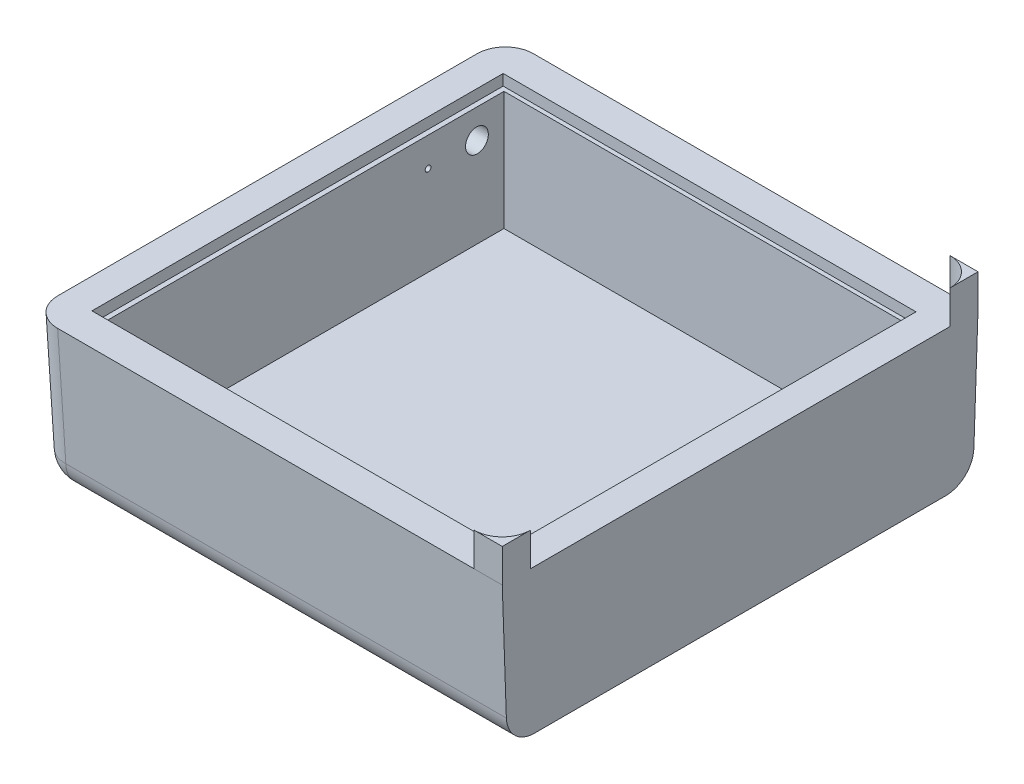
from build123d import *

# Parameters (mm, degrees)
SKETCH1_W               = 295
SKETCH1_H               = 292.1
BOSS_EXTRUDE1_DEPTH     = 88.69
BOSS_EXTRUDE1_DRAFT     = -2
SKETCH3_W               = 253.5
SKETCH3_H               = 252.5
CUT_EXTRUDE3_DEPTH      = 6.5
CUT_EXTRUDE3_DRAFT      = -2
SKETCH5_W               = 247
SKETCH5_H               = 247
CUT_EXTRUDE4_DEPTH      = 70.5
CUT_EXTRUDE4_DRAFT      = -2
CUT_EXTRUDE5_DEPTH      = 228.203831614
CUT_EXTRUDE5_DEPTH_BACK = 228.203831614
FILLET2_R               = 17.27
BOSS_EXTRUDE2_DEPTH     = 20.53
CUT_EXTRUDE6_REACH      = 337.359
SKETCH8_R               = 7
CUT_EXTRUDE7_DEPTH      = 5
CUT_EXTRUDE8_REACH      = 333.091
SKETCH9_R               = 1.75


with BuildPart() as part:
    # Sketch1 → Boss-Extrude1 (with draft: the straight prism first)
    with BuildSketch(Plane(origin=(0, 0, 0), x_dir=(1, 0, 0), z_dir=(0, 1, 0))):
        with Locations((2.25, 0)):
            Rectangle(SKETCH1_W, SKETCH1_H)
    extrude(amount=-BOSS_EXTRUDE1_DEPTH)
    # Boss-Extrude1: the draft: its side faces are tilted about the plane it starts from
    boss_extrude1_sides = [part.faces().sort_by_distance(p)[0] for p in [
        (2.25, -44.345, 146.05),
        (149.75, -44.345, 0),
        (2.25, -44.345, -146.05),
        (-145.25, -44.345, 0),
    ]]
    draft(boss_extrude1_sides, Plane(origin=(0, 0, 0), x_dir=(1, 0, 0), z_dir=(0, 1, 0)), BOSS_EXTRUDE1_DRAFT)


with BuildPart() as cut_extrude3_tool:
    # Sketch3 → Cut-Extrude3 (with draft: the straight prism first)
    with BuildSketch(Plane(origin=(0, 0, 0), x_dir=(1, 0, 0), z_dir=(0, 1, 0))):
        Rectangle(SKETCH3_W, SKETCH3_H)
    extrude(amount=-CUT_EXTRUDE3_DEPTH)
    # Cut-Extrude3: the draft: its side faces are tilted about the plane it starts from
    cut_extrude3_sides = [cut_extrude3_tool.faces().sort_by_distance(p)[0] for p in [
        (0, -3.25, 126.25),
        (126.75, -3.25, 0),
        (0, -3.25, -126.25),
        (-126.75, -3.25, 0),
    ]]
    draft(cut_extrude3_sides, Plane(origin=(0, 0, 0), x_dir=(1, 0, 0), z_dir=(0, 1, 0)), CUT_EXTRUDE3_DRAFT)


with BuildPart() as part_1:
    add(part.part)

    # Cut-Extrude3: cut by cut_extrude3_tool
    add(cut_extrude3_tool.part, mode=Mode.SUBTRACT)


with BuildPart() as cut_extrude4_tool:
    # Sketch5 → Cut-Extrude4 (with draft: the straight prism first)
    with BuildSketch(Plane(origin=(0, -6.5, 0), x_dir=(1, 0, 0), z_dir=(0, 1, 0))):
        Rectangle(SKETCH5_W, SKETCH5_H)
    extrude(amount=-CUT_EXTRUDE4_DEPTH)
    # Cut-Extrude4: the draft: its side faces are tilted about the plane it starts from
    cut_extrude4_sides = [cut_extrude4_tool.faces().sort_by_distance(p)[0] for p in [
        (0, -41.75, 123.5),
        (123.5, -41.75, 0),
        (0, -41.75, -123.5),
        (-123.5, -41.75, 0),
    ]]
    draft(cut_extrude4_sides, Plane(origin=(0, -6.5, 0), x_dir=(1, 0, 0), z_dir=(0, 1, 0)), CUT_EXTRUDE4_DRAFT)


with BuildPart() as part_2:
    add(part_1.part)

    # Cut-Extrude4: cut by cut_extrude4_tool
    add(cut_extrude4_tool.part, mode=Mode.SUBTRACT)

    # Sketch6 → Cut-Extrude5 (cut, two sides: drawn at the far end of the back side and taken through both)
    with BuildSketch(Plane.XY.offset(-CUT_EXTRUDE5_DEPTH_BACK)):
        Polygon((149.75, 0), (145, 0), (145, -88.69), (146.652876954, -88.69), align=None)
    extrude(amount=CUT_EXTRUDE5_DEPTH + CUT_EXTRUDE5_DEPTH_BACK, mode=Mode.SUBTRACT)

    # Fillet2
    fillet2_edges = [part_2.edges().sort_by_distance(p)[0] for p in [
        (1.423561523, -88.69, -142.952876954),
        (-143.701438477, -44.345, -144.501438477),
        (-142.152876954, -88.69, 0),
        (-143.701438477, -44.345, 144.501438477),
        (1.423561523, -88.69, 142.952876954),
    ]]
    fillet(fillet2_edges, radius=FILLET2_R)

    # Sketch7 → Boss-Extrude2 (add)
    with BuildSketch(Plane(origin=(0, 0, 0), x_dir=(1, 0, 0), z_dir=(0, 1, 0))):
        with BuildLine():
            Line((145, 128.78), (145, 146.05))
            Line((145, 146.05), (127.73, 146.05))
            ThreePointArc((127.73, 146.05), (139.941734111, 140.991734111), (145, 128.78))
        make_face()
        with BuildLine():
            Line((145, -146.05), (127.73, -146.05))
            ThreePointArc((127.73, -146.05), (139.941734111, -140.991734111), (145, -128.78))
            Line((145, -128.78), (145, -146.05))
        make_face()
    extrude(amount=BOSS_EXTRUDE2_DEPTH)

    # Sketch8 → Cut-Extrude6 (cut, up to next)
    with BuildSketch(Plane(origin=(-145.07308915, -5.066063906, 0), x_dir=(0, 0, 1), z_dir=(-0.9993908270190958, -0.03489949670250105, 0)), mode=Mode.PRIVATE) as cut_extrude6_sk1:
        with Locations((-106.3, -19.400848104)):
            Circle(SKETCH8_R)
    cut_extrude6_tool1 = extrude(cut_extrude6_sk1.sketch, amount=-CUT_EXTRUDE6_REACH, mode=Mode.PRIVATE) & part_2.part
    add(cut_extrude6_tool1.solids().sort_by_distance((-144.396009, -24.455094, -106.3))[0], mode=Mode.SUBTRACT)

    # Sketch8<3> → Cut-Extrude7 (cut)
    with BuildSketch(Plane(origin=(-145.07308915, -5.066063906, 0), x_dir=(0, 0, 1), z_dir=(-0.9993908270190958, -0.03489949670250105, 0))):
        with BuildLine():
            ThreePointArc((-82, -21.250848104), (-81.707106781, -21.957954885), (-81, -22.250848104))
            Line((-81, -22.250848104), (-71.6, -22.250848104))
            ThreePointArc((-71.6, -22.250848104), (-70.892893219, -21.957954885), (-70.6, -21.250848104))
            Line((-70.6, -21.250848104), (-70.6, -17.550848104))
            ThreePointArc((-70.6, -17.550848104), (-70.892893219, -16.843741323), (-71.6, -16.550848104))
            Line((-71.6, -16.550848104), (-81, -16.550848104))
            ThreePointArc((-81, -16.550848104), (-81.707106781, -16.843741323), (-82, -17.550848104))
            Line((-82, -17.550848104), (-82, -21.250848104))
        make_face()
    extrude(amount=-CUT_EXTRUDE7_DEPTH, mode=Mode.SUBTRACT)

    # Sketch9 → Cut-Extrude8 (cut, up to next)
    with BuildSketch(Plane(origin=(-140.076135015, -4.891566422, 0), x_dir=(0, 0, 1), z_dir=(-0.9993908270190958, -0.03489949670250113, 0)), mode=Mode.PRIVATE) as cut_extrude8_sk1:
        with Locations((-76.3, -19.400848104)):
            Circle(SKETCH9_R)
    cut_extrude8_tool1 = extrude(cut_extrude8_sk1.sketch, amount=-CUT_EXTRUDE8_REACH, mode=Mode.PRIVATE) & part_2.part
    add(cut_extrude8_tool1.solids().sort_by_distance((-139.399055, -24.280596, -76.3))[0], mode=Mode.SUBTRACT)


solid = part_2.part
